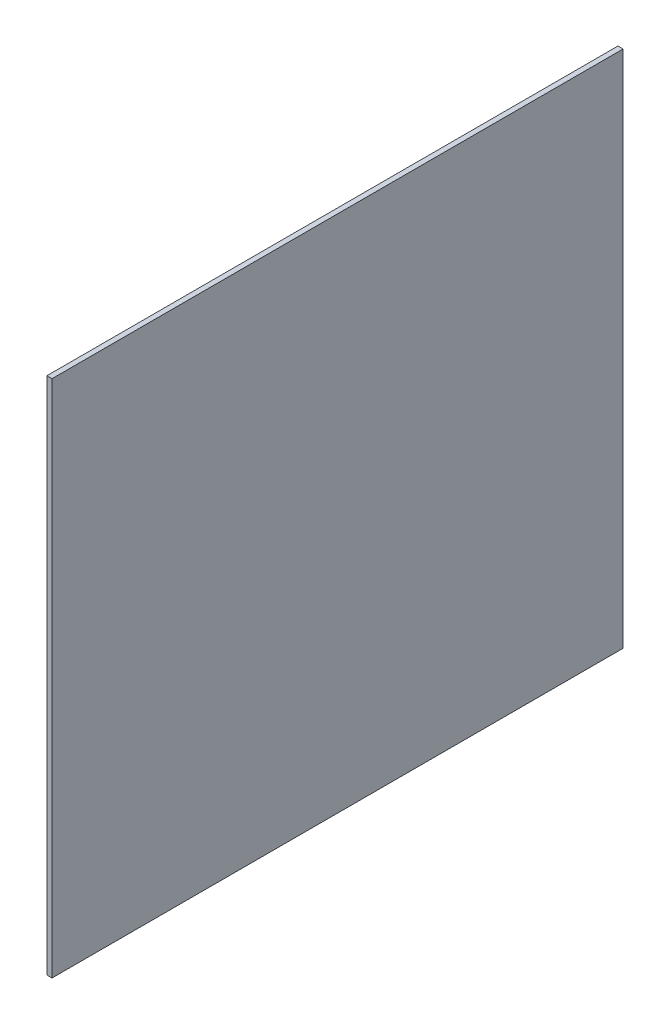
from build123d import *

# Parameters (mm, degrees)
SKETCH1_W           = 1.39446
SKETCH1_H           = 140.88108
BOSS_EXTRUDE1_DEPTH = 155


with BuildPart() as part:
    # Sketch1 → Boss-Extrude1 (new body)
    with BuildSketch(Plane.XY):
        with Locations((151.57831, -70.44054)):
            Rectangle(SKETCH1_W, SKETCH1_H)
    extrude(amount=BOSS_EXTRUDE1_DEPTH)


solid = part.part
